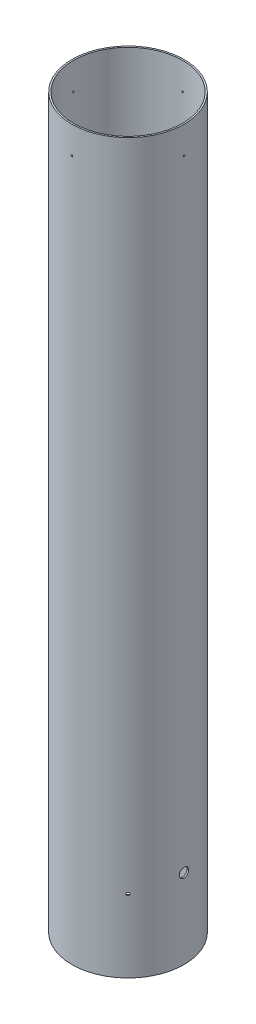
from build123d import *

# Parameters (mm, degrees)
SKETCH1_R           = 78.359
SKETCH1_R_2         = 76.1746
BOSS_EXTRUDE1_DEPTH = 1016
SKETCH2_R           = 1.0922
CUT_EXTRUDE1_DEPTH  = 1023.025570014
CIRPATTERN1_COUNT   = 4
CIRPATTERN2_COUNT   = 4


with BuildPart() as part:
    # Sketch1 → Boss-Extrude1 (new body)
    with BuildSketch(Plane(origin=(0, 0, 0), x_dir=(1, 0, 0), z_dir=(0, 1, 0))):
        Circle(SKETCH1_R)
        Circle(SKETCH1_R_2, mode=Mode.SUBTRACT)
    extrude(amount=BOSS_EXTRUDE1_DEPTH)

    # Sketch2 → Cut-Extrude1 (cut, through all)
    with BuildSketch(Plane(origin=(0, 0, 0), x_dir=(0, 0, -1), z_dir=(1, 0, 0))):
        with Locations((0, 977.9)):
            Circle(SKETCH2_R)
    cut_extrude1 = extrude(amount=-CUT_EXTRUDE1_DEPTH, mode=Mode.SUBTRACT)

    # CirPattern1: Cut-Extrude1 ×4 about axis
    cirpattern1_axis = Axis((0, 1016, 0), (0, 1, 0))
    for i in range(1, CIRPATTERN1_COUNT):
        add(cut_extrude1.rotate(cirpattern1_axis, i * 360 / CIRPATTERN1_COUNT), mode=Mode.SUBTRACT)

    # Sketch4 → 1/2 Clearance Hole1 (revolve, cut)
    with BuildSketch(Plane.ZX.offset(111.125)):
        Polygon((0, 0), (0, 92.834507437), (6.54812, 88.9), (6.54812, 0), align=None)
    revolve(axis=Axis((-6.35, 111.125, 0), (1, 0, 0)), mode=Mode.SUBTRACT)

    # Sketch6 → Ø4.0 (4) Diameter Hole - Forward Body Tube Secure (revolve, cut)
    with BuildSketch(Plane(origin=(0, 101.6, 0), x_dir=(-0.7071067811865488, 0, 0.7071067811865464), z_dir=(0, 1, 0))):
        Polygon((0, 0), (0, 90.101721238), (2, 88.9), (2, 0), align=None)
    f_4_0_4_diameter_hole_forward_body_tub = revolve(axis=Axis((-4.490128061, 101.6, -4.490128061), (0.7071067811865464, 0, 0.7071067811865487)), mode=Mode.SUBTRACT)

    # CirPattern2: Ø4.0 (4) Diameter Hole - Forward Body Tube Secure ×4 about axis
    cirpattern2_axis = Axis((0, 0, 0), (0, 1, 0))
    for i in range(1, CIRPATTERN2_COUNT):
        add(f_4_0_4_diameter_hole_forward_body_tub.rotate(cirpattern2_axis, i * 360 / CIRPATTERN2_COUNT), mode=Mode.SUBTRACT)


solid = part.part
